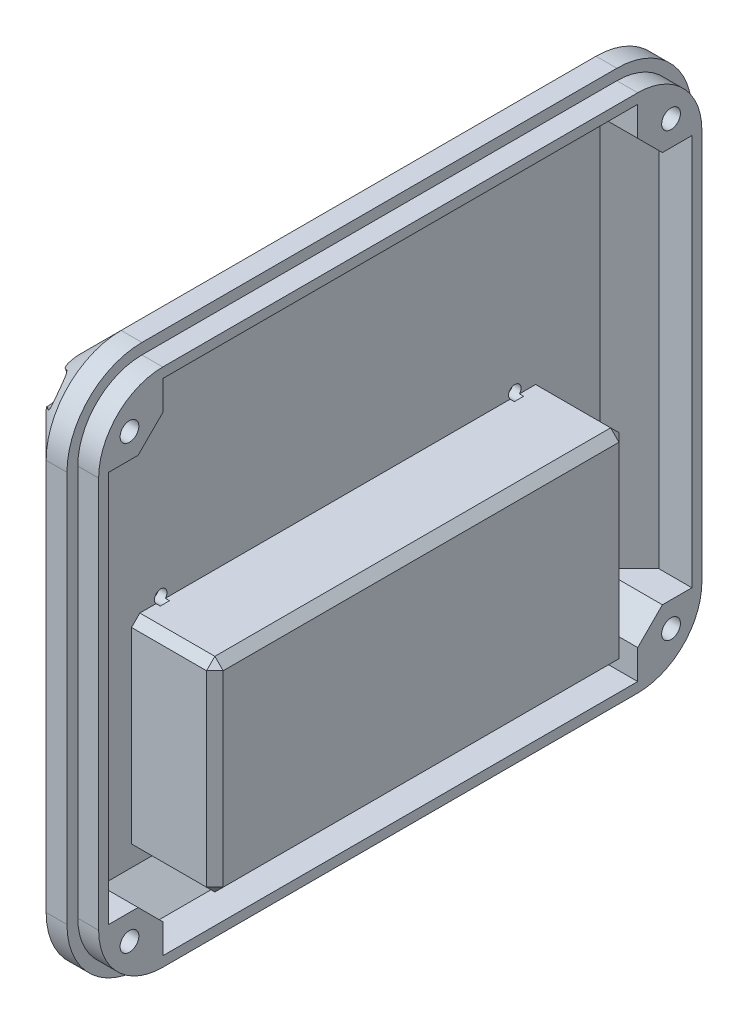
from build123d import *

# Parameters (mm, degrees)
EXTRUDE_4_DEPTH     = 15
CHAMFER_2_SIZE      = 10
SHELL_3_T           = -5
EXTRUDE_5_DEPTH     = 5
EXTRUDE_6_REACH     = 103.242
SKETCH_6_R          = 2.25
CUT_EXTRUDE_1_DEPTH = 43
SKETCH_7_R          = 3.75
CUT_EXTRUDE_2_DEPTH = 16
FILLET_1_R          = 2
SKETCH_8_W          = 93
SKETCH_8_H          = 43
CUT_EXTRUDE_3_DEPTH = 16
SKETCH_12_W         = 99
SKETCH_12_H         = 49
SKETCH_12_W_2       = 93
SKETCH_12_H_2       = 43
EXTRUDE_7_DEPTH     = 18
SKETCH_14_W         = 99
SKETCH_14_H         = 49
EXTRUDE_8_DEPTH     = 2
CHAMFER_4_SIZE      = 2
CUT_EXTRUDE_5_DEPTH = 3
SKETCH_17_R         = 1.5
CUT_EXTRUDE_6_DEPTH = 3


with BuildPart() as part:
    # 草图3 → 凸台-拉伸4 (new body)
    with BuildSketch(Plane(origin=(0, 0, 0), x_dir=(0, 0, -1), z_dir=(1, 0, 0))):
        with BuildLine():
            Line((-57, -65), (57, -65))
            ThreePointArc((57, -65), (69.727922061, -59.727922061), (75, -47))
            Line((75, -47), (75, 47))
            ThreePointArc((75, 47), (69.727922061, 59.727922061), (57, 65))
            Line((57, 65), (-57, 65))
            ThreePointArc((-57, 65), (-69.727922061, 59.727922061), (-75, 47))
            Line((-75, 47), (-75, -47))
            ThreePointArc((-75, -47), (-69.727922061, -59.727922061), (-57, -65))
        make_face()
    extrude(amount=EXTRUDE_4_DEPTH)

    # 倒角2
    chamfer_2_edges = [part.edges().sort_by_distance(p)[0] for p in [
        (0, 0, -75),
        (0, 59.727922061, -69.727922061),
        (0, 65, 0),
        (0, 59.727922061, 69.727922061),
        (0, 0, 75),
        (0, -59.727922061, 69.727922061),
        (0, -65, 0),
        (0, -59.727922061, -69.727922061),
    ]]
    chamfer(chamfer_2_edges, length=CHAMFER_2_SIZE)

    # 抽壳3
    shell_3_openings = [part.faces().sort_by_distance(p)[0] for p in [
        (15, 0, 0),
    ]]
    offset(amount=SHELL_3_T, openings=shell_3_openings, kind=Kind.INTERSECTION)

    # 草图4 → 凸台-拉伸5 (add)
    with BuildSketch(Plane(origin=(15, 0, 0), x_dir=(0, 0, -1), z_dir=(1, 0, 0))):
        with BuildLine():
            Line((72.4, -47), (72.4, 47))
            ThreePointArc((72.4, 47), (67.88944443, 57.88944443), (57, 62.4))
            Line((57, 62.4), (-57, 62.4))
            ThreePointArc((-57, 62.4), (-67.88944443, 57.88944443), (-72.4, 47))
            Line((-72.4, 47), (-72.4, -47))
            ThreePointArc((-72.4, -47), (-67.88944443, -57.88944443), (-57, -62.4))
            Line((-57, -62.4), (57, -62.4))
            ThreePointArc((57, -62.4), (67.88944443, -57.88944443), (72.4, -47))
        make_face()
        with BuildLine():
            Line((70, -47), (70, 47))
            ThreePointArc((70, 47), (66.192388155, 56.192388155), (57, 60))
            Line((57, 60), (-57, 60))
            ThreePointArc((-57, 60), (-66.192388155, 56.192388155), (-70, 47))
            Line((-70, 47), (-70, -47))
            ThreePointArc((-70, -47), (-66.192388155, -56.192388155), (-57, -60))
            Line((-57, -60), (57, -60))
            ThreePointArc((57, -60), (66.192388155, -56.192388155), (70, -47))
        make_face(mode=Mode.SUBTRACT)
    extrude(amount=EXTRUDE_5_DEPTH)

    # 草图5 → 凸台-拉伸6 (add, up to next)
    with BuildSketch(Plane(origin=(20, 0, 0), x_dir=(0, 0, -1), z_dir=(1, 0, 0)), mode=Mode.PRIVATE) as extrude_6_sk1:
        with BuildLine():
            Line((-57, 52.928932188), (-62.928932188, 47))
            Line((-62.928932188, 47), (-70, 47))
            ThreePointArc((-70, 47), (-66.192388155, 56.192388155), (-57, 60))
            Line((-57, 60), (-57, 52.928932188))
        make_face()
    extrude_6_tool1 = extrude(extrude_6_sk1.sketch, amount=-EXTRUDE_6_REACH, mode=Mode.PRIVATE) - part.part
    # 草图5 → 凸台-拉伸6 (add, up to next)
    with BuildSketch(Plane(origin=(20, 0, 0), x_dir=(0, 0, -1), z_dir=(1, 0, 0)), mode=Mode.PRIVATE) as extrude_6_sk2:
        with BuildLine():
            Line((57, 60), (57, 52.928932188))
            Line((57, 52.928932188), (62.928932188, 47))
            Line((62.928932188, 47), (70, 47))
            ThreePointArc((70, 47), (66.192388155, 56.192388155), (57, 60))
        make_face()
    extrude_6_tool2 = extrude(extrude_6_sk2.sketch, amount=-EXTRUDE_6_REACH, mode=Mode.PRIVATE) - part.part
    # 草图5 → 凸台-拉伸6 (add, up to next)
    with BuildSketch(Plane(origin=(20, 0, 0), x_dir=(0, 0, -1), z_dir=(1, 0, 0)), mode=Mode.PRIVATE) as extrude_6_sk3:
        with BuildLine():
            Line((62.928932188, -47), (70, -47))
            ThreePointArc((70, -47), (66.192388155, -56.192388155), (57, -60))
            Line((57, -60), (57, -52.928932188))
            Line((57, -52.928932188), (62.928932188, -47))
        make_face()
    extrude_6_tool3 = extrude(extrude_6_sk3.sketch, amount=-EXTRUDE_6_REACH, mode=Mode.PRIVATE) - part.part
    # 草图5 → 凸台-拉伸6 (add, up to next)
    with BuildSketch(Plane(origin=(20, 0, 0), x_dir=(0, 0, -1), z_dir=(1, 0, 0)), mode=Mode.PRIVATE) as extrude_6_sk4:
        with BuildLine():
            Line((-57, -60), (-57, -52.928932188))
            Line((-57, -52.928932188), (-62.928932188, -47))
            Line((-62.928932188, -47), (-70, -47))
            ThreePointArc((-70, -47), (-66.192388155, -56.192388155), (-57, -60))
        make_face()
    extrude_6_tool4 = extrude(extrude_6_sk4.sketch, amount=-EXTRUDE_6_REACH, mode=Mode.PRIVATE) - part.part
    add(extrude_6_tool1.solids().sort_by_distance((20, 53.057838, 63.057838))[0])
    add(extrude_6_tool2.solids().sort_by_distance((20, 53.057838, -63.057838))[0])
    add(extrude_6_tool3.solids().sort_by_distance((20, -53.057838, -63.057838))[0])
    add(extrude_6_tool4.solids().sort_by_distance((20, -53.057838, 63.057838))[0])

    # 草图6 → 切除-拉伸1 (cut)
    with BuildSketch(Plane(origin=(20, 0, 0), x_dir=(0, 0, -1), z_dir=(1, 0, 0))):
        with Locations((65, 53)):
            Circle(SKETCH_6_R)
        with Locations((-65, 53)):
            Circle(SKETCH_6_R)
        with Locations((65, -53)):
            Circle(SKETCH_6_R)
        with Locations((-65, -53)):
            Circle(SKETCH_6_R)
    extrude(amount=-CUT_EXTRUDE_1_DEPTH, mode=Mode.SUBTRACT)

    # 草图7 → 切除-拉伸2 (cut)
    with BuildSketch(Plane.ZY):
        with Locations((65, 53)):
            Circle(SKETCH_7_R)
        with Locations((-65, 53)):
            Circle(SKETCH_7_R)
        with Locations((-65, -53)):
            Circle(SKETCH_7_R)
        with Locations((65, -53)):
            Circle(SKETCH_7_R)
    extrude(amount=-CUT_EXTRUDE_2_DEPTH, mode=Mode.SUBTRACT)

    # 圆角1
    fillet_1_edges = [part.edges().sort_by_distance(p)[0] for p in [
        (0, -50.75, 62),
        (0, -50.466645488, -62.235110324),
        (0, 50.466645488, -62.235110324),
        (0, 50.75, 62),
    ]]
    fillet(fillet_1_edges, radius=FILLET_1_R)

    # 草图8 → 切除-拉伸3 (cut)
    with BuildSketch(Plane.ZY):
        with Locations((0, -25.5)):
            Rectangle(SKETCH_8_W, SKETCH_8_H)
    extrude(amount=-CUT_EXTRUDE_3_DEPTH, mode=Mode.SUBTRACT)

    # 草图12 → 凸台-拉伸7 (add)
    with BuildSketch(Plane(origin=(5, 0, 0), x_dir=(0, 0, -1), z_dir=(1, 0, 0))):
        with Locations((0, -25.5)):
            Rectangle(SKETCH_12_W, SKETCH_12_H)
        with Locations((0, -25.5)):
            Rectangle(SKETCH_12_W_2, SKETCH_12_H_2, mode=Mode.SUBTRACT)
    extrude(amount=EXTRUDE_7_DEPTH)

    # 草图14 → 凸台-拉伸8 (add)
    with BuildSketch(Plane(origin=(23, 0, 0), x_dir=(0, 0, -1), z_dir=(1, 0, 0))):
        with Locations((0, -25.5)):
            Rectangle(SKETCH_14_W, SKETCH_14_H)
    extrude(amount=EXTRUDE_8_DEPTH)

    # 倒角4
    chamfer_4_edges = [part.edges().sort_by_distance(p)[0] for p in [
        (25, -1, 0),
        (15, -1, -49.5),
        (25, -25.5, -49.5),
        (15, -50, -49.5),
        (25, -50, 0),
        (15, -50, 49.5),
        (25, -25.5, 49.5),
        (15, -1, 49.5),
    ]]
    chamfer(chamfer_4_edges, length=CHAMFER_4_SIZE)

    # 草图15 → 切除-拉伸5 (cut)
    with BuildSketch(Plane.ZY):
        with BuildLine():
            Line((-46.5, -4), (-38.5, -4))
            Line((-38.5, -4), (-38.5, 0))
            ThreePointArc((-38.5, 0), (-42.5, 4), (-46.5, 0))
            Line((-46.5, 0), (-46.5, -4))
        make_face()
        with BuildLine():
            Line((46.5, -47), (38.5, -47))
            Line((38.5, -47), (38.5, -51))
            ThreePointArc((38.5, -51), (42.5, -55), (46.5, -51))
            Line((46.5, -51), (46.5, -47))
        make_face()
        with BuildLine():
            Line((-38.5, -47), (-38.5, -51))
            ThreePointArc((-38.5, -51), (-42.5, -55), (-46.5, -51))
            Line((-46.5, -51), (-46.5, -47))
            Line((-46.5, -47), (-38.5, -47))
        make_face()
        with BuildLine():
            Line((38.5, -4), (38.5, 0))
            ThreePointArc((38.5, 0), (42.5, 4), (46.5, 0))
            Line((46.5, 0), (46.5, -4))
            Line((46.5, -4), (38.5, -4))
        make_face()
    extrude(amount=-CUT_EXTRUDE_5_DEPTH, mode=Mode.SUBTRACT)

    # 草图17 → 切除-拉伸6 (cut)
    with BuildSketch(Plane.ZY.offset(-3)):
        with Locations((42.5, 0)):
            Circle(SKETCH_17_R)
        with Locations((42.5, -51)):
            Circle(SKETCH_17_R)
        with Locations((-42.5, -51)):
            Circle(SKETCH_17_R)
        with Locations((-42.5, 0)):
            Circle(SKETCH_17_R)
    extrude(amount=-CUT_EXTRUDE_6_DEPTH, mode=Mode.SUBTRACT)


solid = part.part
